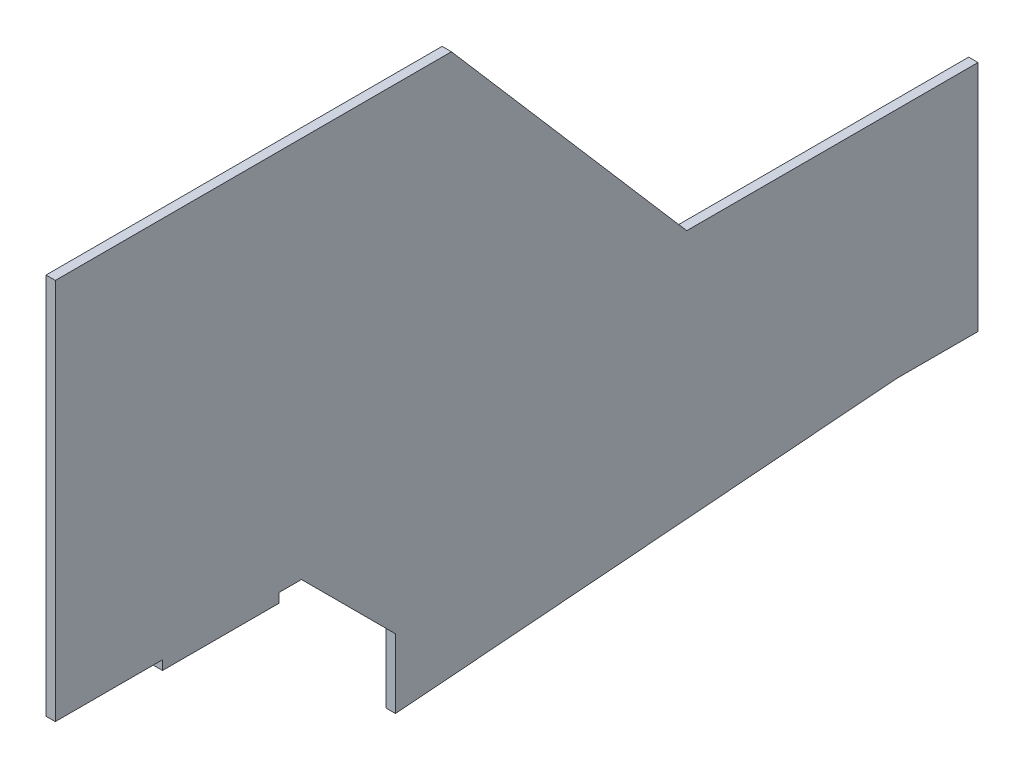
from build123d import *

# Parameters (mm, degrees)
SALIENTE_EXTRUIR1_DEPTH = 4


with BuildPart() as part:
    # Croquis2 → Saliente-Extruir1 (new body)
    with BuildSketch(Plane(origin=(0, 0, 0), x_dir=(0, 0, -1), z_dir=(1, 0, 0))):
        Polygon((-196, 89), (-196, -75), (-150, -75), (-150, -79), (-100, -79), (-100, -75), (-90.353418897, -75), (-50, -115.353418897), (-50, -145), (165, -128), (200, -128), (200, -28), (75, -28), (-26, 89), align=None)
    extrude(amount=SALIENTE_EXTRUIR1_DEPTH)


solid = part.part
